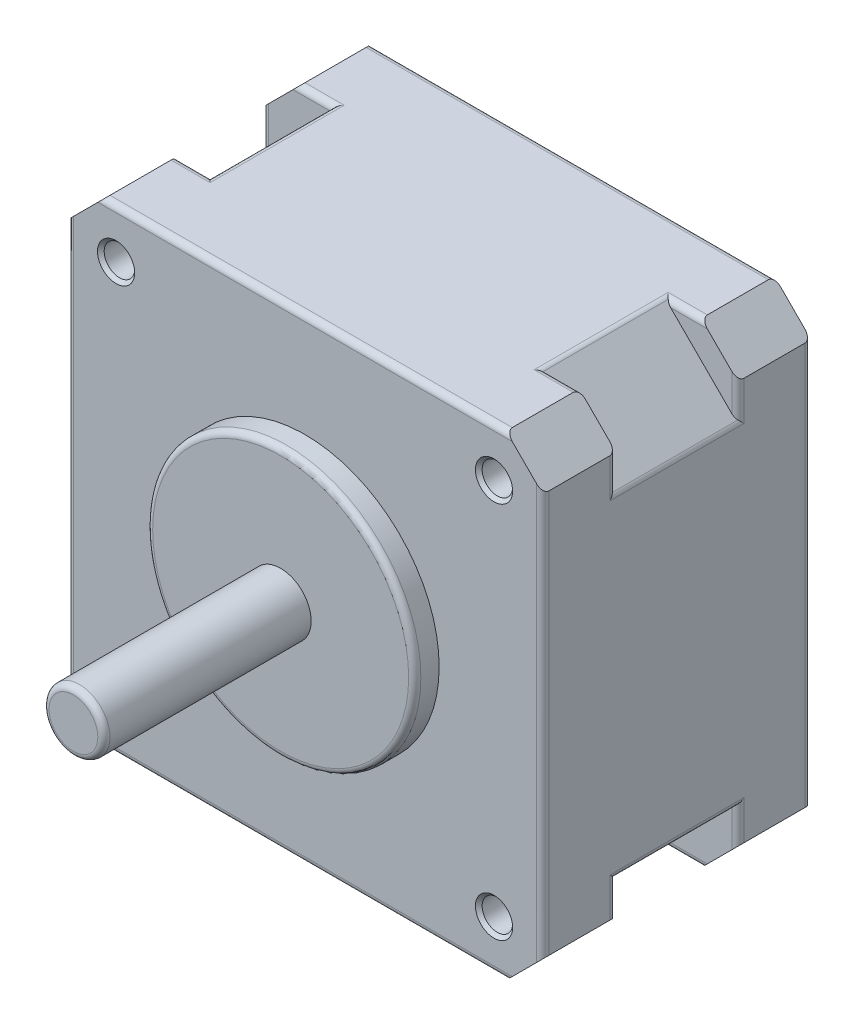
from build123d import *

# Parameters (mm, degrees)
SKETCH_1_W               = 39
SKETCH_1_H               = 39
EXTRUDE_1_DEPTH          = 22
SKETCH_2_R               = 11
EXTRUDE_2_DEPTH          = 2
SKETCH_3_R               = 2.5
EXTRUDE_3_DEPTH          = 17
CUT_EXTRUDE_1_DEPTH      = 5
CUT_EXTRUDE_1_DEPTH_BACK = 5
FILLET_1_R               = 0.5
CUT_EXTRUDE_2_DEPTH      = 36.277471565


# Read off the part's stored shape, not the designer's step: M3 螺纹孔1
with BuildPart() as part:
    # 草图1 → 凸台-拉伸1 (new body)
    with BuildSketch(Plane.XY):
        Rectangle(SKETCH_1_W, SKETCH_1_H)
    extrude(amount=EXTRUDE_1_DEPTH)

    # 草图2 → 凸台-拉伸2 (add)
    with BuildSketch(Plane.XY.offset(22)):
        Circle(SKETCH_2_R)
    extrude(amount=EXTRUDE_2_DEPTH)

    # 草图3 → 凸台-拉伸3 (add)
    with BuildSketch(Plane.XY.offset(24)):
        Circle(SKETCH_3_R)
    extrude(amount=EXTRUDE_3_DEPTH)

    # 草图5 → 切除-拉伸1 (cut, two sides: drawn at the far end of the back side and taken through both)
    with BuildSketch(Plane.XY.offset(11).offset(-CUT_EXTRUDE_1_DEPTH_BACK)):
        Polygon((13.496470179, 19.5), (19.5, 13.496470179), (19.5, 19.5), align=None)
        Polygon((19.5, -19.5), (13.49647018, -19.5), (19.5, -13.496470179), align=None)
        Polygon((-13.496470179, -19.5), (-19.5, -13.49647018), (-19.5, -19.5), align=None)
        Polygon((-19.5, 13.496470179), (-19.5, 19.5), (-13.496470179, 19.5), align=None)
    extrude(amount=CUT_EXTRUDE_1_DEPTH + CUT_EXTRUDE_1_DEPTH_BACK, mode=Mode.SUBTRACT)

    # 圆角1
    fillet_1_edges = [part.edges().sort_by_distance(p)[0] for p in [
        (-19.5, 0, 22),
        (-11, 0, 24),
        (0, -19.5, 22),
        (-2.5, 0, 41),
        (19.5, -19.5, 3),
        (-19.5, -19.5, 3),
        (-19.5, 19.5, 3),
        (19.5, 19.5, 3),
        (-19.5, 13.496470179, 11),
        (-13.496470179, 19.5, 11),
        (-16.49823509, 19.5, 6),
        (-19.5, 16.49823509, 6),
        (-16.49823509, 19.5, 16),
        (-19.5, 16.49823509, 16),
        (-16.49823509, -19.5, 6),
        (-13.496470179, -19.5, 11),
        (-19.5, -13.49647018, 11),
        (-19.5, -16.49823509, 6),
        (-16.49823509, -19.5, 16),
        (-19.5, -16.49823509, 16),
        (19.5, -16.49823509, 6),
        (19.5, -13.496470179, 11),
        (13.49647018, -19.5, 11),
        (16.49823509, -19.5, 6),
        (19.5, -16.49823509, 16),
        (16.49823509, -19.5, 16),
        (19.5, 0, 22),
        (0, -19.5, 0),
        (16.49823509, 19.5, 6),
        (13.496470179, 19.5, 11),
        (19.5, 13.496470179, 11),
        (19.5, 16.49823509, 6),
        (16.49823509, 19.5, 16),
        (19.5, 16.49823509, 16),
        (-19.5, 0, 0),
        (0, 19.5, 0),
        (19.5, 0, 0),
        (19.5, -19.5, 19),
        (-19.5, -19.5, 19),
        (-19.5, 19.5, 19),
        (19.5, 19.5, 19),
        (0, 19.5, 22),
    ]]
    fillet(fillet_1_edges, radius=FILLET_1_R)

    # 草图6 → 切除-拉伸2 (cut, through all)
    with BuildSketch(Plane.XY.offset(22)):
        Polygon((19.5, 19.5), (16.49823509, 19.5), (19.5, 16.49823509), align=None)
        Polygon((19.5, -19.5), (19.5, -16.49823509), (16.49823509, -19.5), align=None)
        Polygon((-19.5, -19.5), (-16.49823509, -19.5), (-19.5, -16.49823509), align=None)
        Polygon((-19.5, 19.5), (-19.5, 16.49823509), (-16.49823509, 19.5), align=None)
    extrude(amount=-CUT_EXTRUDE_2_DEPTH, mode=Mode.SUBTRACT)

    # M3 螺纹孔1 outline → M3 螺纹孔1 (revolve, cut)
    with BuildSketch(Plane(origin=(-15.5, 15.5, 0), x_dir=(1, 0, 0), z_dir=(0, -1, 0))):
        Polygon((0, 22), (0, 5.248924226), (1.25, 6), (1.25, 21.725), (1.525, 22), align=None)
    hole_wizard_m3_1 = revolve(axis=Axis((-15.5, 15.5, 0), (0, 0, 1)), mode=Mode.SUBTRACT)

    # Hole Wizard M3 _1 2 outline → Hole Wizard M3 _1 2 (revolve, cut)
    with BuildSketch(Plane(origin=(15.5, 15.5, 0), x_dir=(1, 0, 0), z_dir=(0, -1, 0))):
        Polygon((0, 22), (0, 5.248924226), (1.25, 6), (1.25, 21.725), (1.525, 22), align=None)
    hole_wizard_m3_1_2 = revolve(axis=Axis((15.5, 15.5, 0), (0, 0, 1)), mode=Mode.SUBTRACT)

    # 镜向1: M3 螺纹孔1, Hole Wizard M3 _1 2 across plane
    add(hole_wizard_m3_1.mirror(Plane.ZX), mode=Mode.SUBTRACT)
    add(hole_wizard_m3_1_2.mirror(Plane.ZX), mode=Mode.SUBTRACT)


solid = part.part
